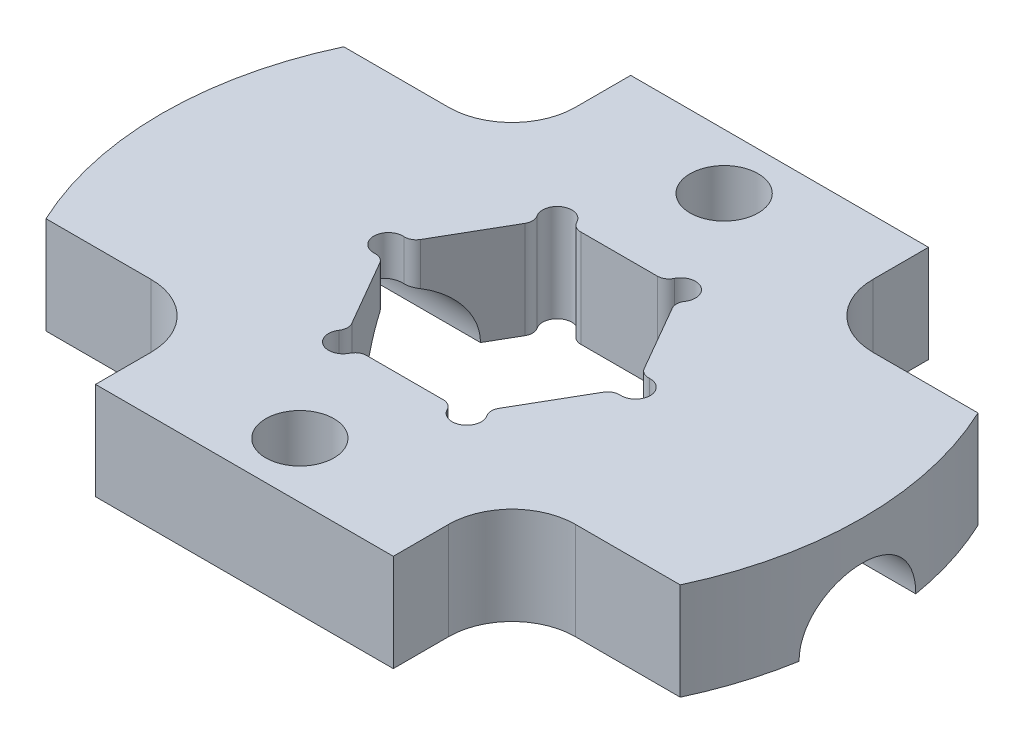
from build123d import *

# Parameters (mm, degrees)
SKIZZE1_R                            = 18
AUFSATZ_LINEAR_AUSTRAGEN1_DEPTH      = 5
SCHNITT_LINEAR_AUSTRAGEN1_DEPTH      = 26.942243542
SCHNITT_LINEAR_AUSTRAGEN1_DEPTH_BACK = 26.942243542
SKIZZE2_OUTSIDE_W                    = 48.232
SKIZZE2_OUTSIDE_H                    = 48.232
SKIZZE2_OUTSIDE_W_2                  = 36
SKIZZE2_OUTSIDE_H_2                  = 27.5
F_3_5_3_5_DURCHMESSER_BOHRUNG1_D     = 3.5
SCHNITT_LINEAR_AUSTRAGEN2_DEPTH      = 24.196174254
SCHNITT_LINEAR_AUSTRAGEN3_DEPTH      = 24.196174254
SKIZZE7_R                            = 3
SCHNITT_LINEAR_AUSTRAGEN4_DEPTH      = 22.5
F_1_5_1_5_DURCHMESSER_BOHRUNG1_D     = 1.5
VERRUNDUNG1_R                        = 0.6


with BuildPart() as part:
    # Skizze1 → Aufsatz-Linear austragen1 (new body)
    with BuildSketch(Plane(origin=(0, 0, 0), x_dir=(1, 0, 0), z_dir=(0, 1, 0))):
        with Locations(Location((0, 0, 0), (0, 0, 270))):
            Circle(SKIZZE1_R)
    extrude(amount=AUFSATZ_LINEAR_AUSTRAGEN1_DEPTH)

    # Skizze2 outside → Schnitt-Linear austragen1 (cut, two sides: drawn at the far end of the back side and taken through both)
    with BuildSketch(Plane(origin=(0, 5, 0), x_dir=(1, 0, 0), z_dir=(0, 1, 0)).offset(-SCHNITT_LINEAR_AUSTRAGEN1_DEPTH_BACK)):
        Rectangle(SKIZZE2_OUTSIDE_W, SKIZZE2_OUTSIDE_H)
        Rectangle(SKIZZE2_OUTSIDE_W_2, SKIZZE2_OUTSIDE_H_2, mode=Mode.SUBTRACT)
    extrude(amount=SCHNITT_LINEAR_AUSTRAGEN1_DEPTH + SCHNITT_LINEAR_AUSTRAGEN1_DEPTH_BACK, mode=Mode.SUBTRACT)

    # Ø3.5 (3.5) Durchmesser Bohrung1 (through all)
    with Locations(Plane(origin=(0, 5, 0), x_dir=(1, 0, 0), z_dir=(0, 1, 0))):
        with Locations((0, 10.9), (0, -10.9)):
            Hole(F_3_5_3_5_DURCHMESSER_BOHRUNG1_D / 2)

    # Skizze5 → Schnitt-Linear austragen2 (cut, through all)
    with BuildSketch(Plane(origin=(0, 5, 0), x_dir=(1, 0, 0), z_dir=(0, 1, 0))):
        with BuildLine():
            Line((-10.9, 7.65), (-17.888484908, 7.65))
            Line((-17.888484908, 7.65), (-17.888484908, 14.15))
            Line((-17.888484908, 14.15), (-7.65, 14.15))
            Line((-7.65, 14.15), (-7.65, 10.9))
            ThreePointArc((-7.65, 10.9), (-8.601902961, 8.601902961), (-10.9, 7.65))
        make_face()
        with BuildLine():
            Line((17.888484908, 14.15), (17.888484908, 7.65))
            Line((17.888484908, 7.65), (10.9, 7.65))
            ThreePointArc((10.9, 7.65), (8.601902961, 8.601902961), (7.65, 10.9))
            Line((7.65, 10.9), (7.65, 14.15))
            Line((7.65, 14.15), (17.888484908, 14.15))
        make_face()
        with BuildLine():
            Line((-17.888484908, -14.15), (-17.888484908, -7.65))
            Line((-17.888484908, -7.65), (-10.9, -7.65))
            ThreePointArc((-10.9, -7.65), (-8.601902961, -8.601902961), (-7.65, -10.9))
            Line((-7.65, -10.9), (-7.65, -14.15))
            Line((-7.65, -14.15), (-17.888484908, -14.15))
        make_face()
        with BuildLine():
            Line((10.9, -7.65), (17.888484908, -7.65))
            Line((17.888484908, -7.65), (17.888484908, -14.15))
            Line((17.888484908, -14.15), (7.65, -14.15))
            Line((7.65, -14.15), (7.65, -10.9))
            ThreePointArc((7.65, -10.9), (8.601902961, -8.601902961), (10.9, -7.65))
        make_face()
    extrude(amount=-SCHNITT_LINEAR_AUSTRAGEN2_DEPTH, mode=Mode.SUBTRACT)

    # Skizze6 → Schnitt-Linear austragen3 (cut, through all)
    with BuildSketch(Plane(origin=(0, 5, 0), x_dir=(1, 0, 0), z_dir=(0, 1, 0))):
        Polygon((6.350852961, 0), (3.175426481, 5.5), (-3.175426481, 5.5), (-6.350852961, 0), (-3.175426481, -5.5), (3.175426481, -5.5), align=None)
    extrude(amount=-SCHNITT_LINEAR_AUSTRAGEN3_DEPTH, mode=Mode.SUBTRACT)

    # Skizze7 → Schnitt-Linear austragen4 (cut, symmetric)
    with BuildSketch(Plane(origin=(0, 0, 0), x_dir=(0, 0, -1), z_dir=(1, 0, 0))):
        Circle(SKIZZE7_R)
    extrude(amount=SCHNITT_LINEAR_AUSTRAGEN4_DEPTH, both=True, mode=Mode.SUBTRACT)

    # Ø1.5 (1.5) Durchmesser Bohrung1 (through all)
    with Locations(Plane(origin=(0, 5, 0), x_dir=(1, 0, 0), z_dir=(0, 1, 0))):
        with Locations((3.175426481, 5.5), (-3.175426481, 5.5), (-6.350852961, 0), (-3.175426481, -5.5), (3.175426481, -5.5), (6.350852961, 0)):
            Hole(F_1_5_1_5_DURCHMESSER_BOHRUNG1_D / 2)

    # Verrundung1
    # the kernel refuses this fillet: 0.6 mm, written as the material it takes off along each edge
    with BuildSketch(Plane(origin=(-5.975852961, 6.148346656, -0.649519053), x_dir=(0.4999999999999993, 0, -0.8660254037844392), z_dir=(0, -1, 0))) as verrundung1_piece_1:
        with BuildLine():
            CenterArc((0.459338662, -0.6), VERRUNDUNG1_R, 90, 63.612200035)
            ThreePointArc((-0.078145188, -0.333333333), (-0.019797593, -0.171185412), (0, 0))
            Line((0, 0), (0.459338662, 0))
        make_face()
    extrude(amount=4.367849683, mode=Mode.SUBTRACT)
    with BuildSketch(Plane(origin=(-5.975852961, 6.148346656, 0.649519053), x_dir=(0.5000000000000006, 0, 0.8660254037844383), z_dir=(0, -1, 0)), Plane(origin=(5.975852961, 6.148346656, -0.649519053), x_dir=(-0.5000000000000003, 0, -0.8660254037844385), z_dir=(0, -1, 0))) as verrundung1_piece_2:
        with BuildLine():
            CenterArc((0.459338662, 0.6), VERRUNDUNG1_R, 206.387799965, 63.612200035)
            ThreePointArc((-0.078145188, 0.333333333), (-0.019797593, 0.171185412), (0, 0))
            Line((0, 0), (0.459338662, 0))
        make_face()
    extrude(amount=4.367849683, mode=Mode.SUBTRACT)
    with BuildSketch(Plane(origin=(-3.550426481, 6.148346656, 4.850480947), x_dir=(-0.49999999999999917, 0, -0.866025403784439), z_dir=(0, -1, 0)), Plane(origin=(3.550426481, 6.148346656, -4.850480947), x_dir=(0.5000000000000006, 0, 0.8660254037844383), z_dir=(0, -1, 0))) as verrundung1_piece_3:
        with BuildLine():
            CenterArc((0.459338662, -0.6), VERRUNDUNG1_R, 90, 63.612200058)
            ThreePointArc((-0.078145188, -0.333333334), (-0.019797593, -0.171185412), (0, 0))
            Line((0, 0), (0.459338662, 0))
        make_face()
    extrude(amount=7.296693312, mode=Mode.SUBTRACT)
    with BuildSketch(Plane(origin=(-2.425426481, 6.148346656, 5.5), x_dir=(-0.22824721632736633, 0, 0.9736032088272966), z_dir=(0, -1, 0)), Plane(origin=(2.425426481, 6.148346656, -5.5), x_dir=(0.22824721632736567, 0, -0.9736032088272967), z_dir=(0, -1, 0))) as verrundung1_piece_4:
        with BuildLine():
            CenterArc((0.479319154, -0.584161925), VERRUNDUNG1_R, 103.193899981, 63.612200039)
            Line((-0.104842771, -0.447213595), (0, 0))
            ThreePointArc((0, 0), (0.171185412, -0.019797593), (0.342370824, 0))
        make_face()
    extrude(amount=7.296693311, mode=Mode.SUBTRACT)
    with BuildSketch(Plane(origin=(2.425426481, 6.148346656, 5.5), x_dir=(-1, 0, 0), z_dir=(0, -1, 0)), Plane(origin=(-2.425426481, 6.148346656, -5.5), x_dir=(1, 0, 0), z_dir=(0, -1, 0))) as verrundung1_piece_5:
        with BuildLine():
            CenterArc((0.459338662, -0.6), VERRUNDUNG1_R, 90, 63.612200039)
            ThreePointArc((-0.078145188, -0.333333333), (-0.019797593, -0.171185412), (0, 0))
            Line((0, 0), (0.459338662, 0))
        make_face()
    extrude(amount=7.296693311, mode=Mode.SUBTRACT)
    with BuildSketch(Plane(origin=(3.550426481, 6.148346656, 4.850480947), x_dir=(0.7290415041794372, 0, 0.6844694917845379), z_dir=(0, -1, 0)), Plane(origin=(-3.550426481, 6.148346656, -4.850480947), x_dir=(-0.729041504179436, 0, -0.6844694917845393), z_dir=(0, -1, 0))) as verrundung1_piece_6:
        with BuildLine():
            CenterArc((0.479319154, -0.584161925), VERRUNDUNG1_R, 103.193899986, 63.612200058)
            Line((-0.104842771, -0.447213596), (0, 0))
            ThreePointArc((0, 0), (0.171185412, -0.019797593), (0.342370825, 0))
        make_face()
    extrude(amount=7.296693312, mode=Mode.SUBTRACT)
    with BuildSketch(Plane(origin=(5.975852961, 6.148346656, 0.649519053), x_dir=(0.9572887202373949, 0, 0.28913371665416454), z_dir=(0, -1, 0))) as verrundung1_piece_7:
        with BuildLine():
            CenterArc((0.479319154, 0.584161925), VERRUNDUNG1_R, 193.193899985, 63.612200035)
            Line((-0.104842771, 0.447213595), (0, 0))
            ThreePointArc((0, 0), (0.171185412, 0.019797593), (0.342370824, 0))
        make_face()
    extrude(amount=4.367849683, mode=Mode.SUBTRACT)


solid = part.part
